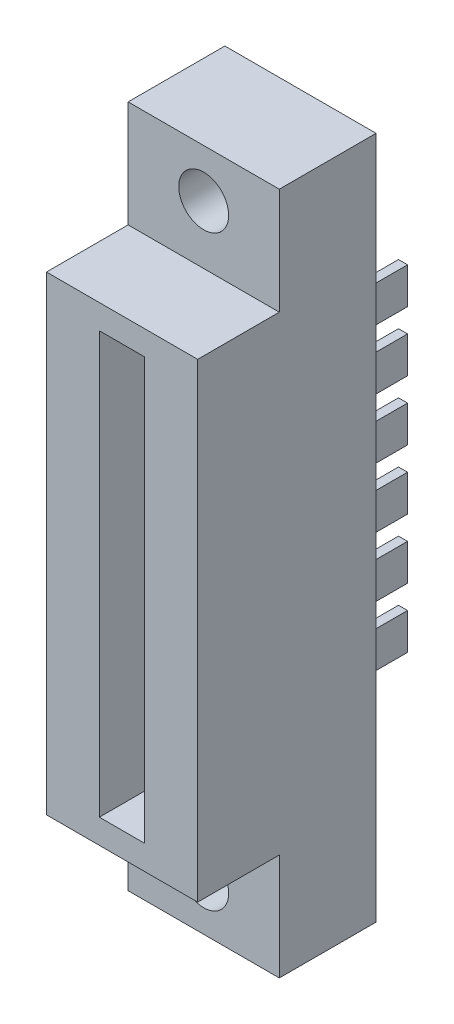
from build123d import *

# Parameters (mm, degrees)
SKETCH_1_W          = 10
SKETCH_1_H          = 45.18
EXTRUDE_1_DEPTH     = 6.4
SKETCH_2_W          = 10
SKETCH_2_H          = 31.09
EXTRUDE_2_DEPTH     = 5.4
SKETCH_3_R          = 1.65
CUT_EXTRUDE_1_DEPTH = 15.3
SKETCH_4_W          = 0.6
SKETCH_4_H          = 2.4
EXTRUDE_3_DEPTH     = 5
SKETCH_5_W          = 3
SKETCH_5_H          = 27.86
CUT_EXTRUDE_2_DEPTH = 8


with BuildPart() as part:
    # 草图1 → 拉伸1 (new body)
    with BuildSketch(Plane.XY):
        Rectangle(SKETCH_1_W, SKETCH_1_H)
    extrude(amount=EXTRUDE_1_DEPTH)

    # 草图2 → 拉伸2 (add)
    with BuildSketch(Plane.XY.offset(6.4)):
        Rectangle(SKETCH_2_W, SKETCH_2_H)
    extrude(amount=EXTRUDE_2_DEPTH)

    # 草图3 → 切除-拉伸1 (cut)
    with BuildSketch(Plane.XY.offset(6.4)):
        with Locations((0, 19.415)):
            Circle(SKETCH_3_R)
        with Locations((0, -19.415)):
            Circle(SKETCH_3_R)
    extrude(amount=-CUT_EXTRUDE_1_DEPTH, mode=Mode.SUBTRACT)

    # 草图4 → 拉伸3 (add)
    with BuildSketch(Plane(origin=(0, 0, 0), x_dir=(-1, 0, 0), z_dir=(0, 0, -1))):
        with Locations((-1.781125105, 1.98)):
            Rectangle(SKETCH_4_W, SKETCH_4_H)
        with Locations((1.781125105, 1.98)):
            Rectangle(SKETCH_4_W, SKETCH_4_H)
        with Locations((-1.781125105, 5.94)):
            Rectangle(SKETCH_4_W, SKETCH_4_H)
        with Locations((1.781125105, 5.94)):
            Rectangle(SKETCH_4_W, SKETCH_4_H)
        with Locations((-1.781125105, 9.9)):
            Rectangle(SKETCH_4_W, SKETCH_4_H)
        with Locations((1.781125105, 9.9)):
            Rectangle(SKETCH_4_W, SKETCH_4_H)
        with Locations((1.781125105, -9.9)):
            Rectangle(SKETCH_4_W, SKETCH_4_H)
        with Locations((-1.781125105, -9.9)):
            Rectangle(SKETCH_4_W, SKETCH_4_H)
        with Locations((1.781125105, -5.94)):
            Rectangle(SKETCH_4_W, SKETCH_4_H)
        with Locations((-1.781125105, -5.94)):
            Rectangle(SKETCH_4_W, SKETCH_4_H)
        with Locations((1.781125105, -1.98)):
            Rectangle(SKETCH_4_W, SKETCH_4_H)
        with Locations((-1.781125105, -1.98)):
            Rectangle(SKETCH_4_W, SKETCH_4_H)
    extrude(amount=EXTRUDE_3_DEPTH)

    # 草图5 → 切除-拉伸2 (cut)
    with BuildSketch(Plane.XY.offset(11.8)):
        Rectangle(SKETCH_5_W, SKETCH_5_H)
    extrude(amount=-CUT_EXTRUDE_2_DEPTH, mode=Mode.SUBTRACT)


solid = part.part
